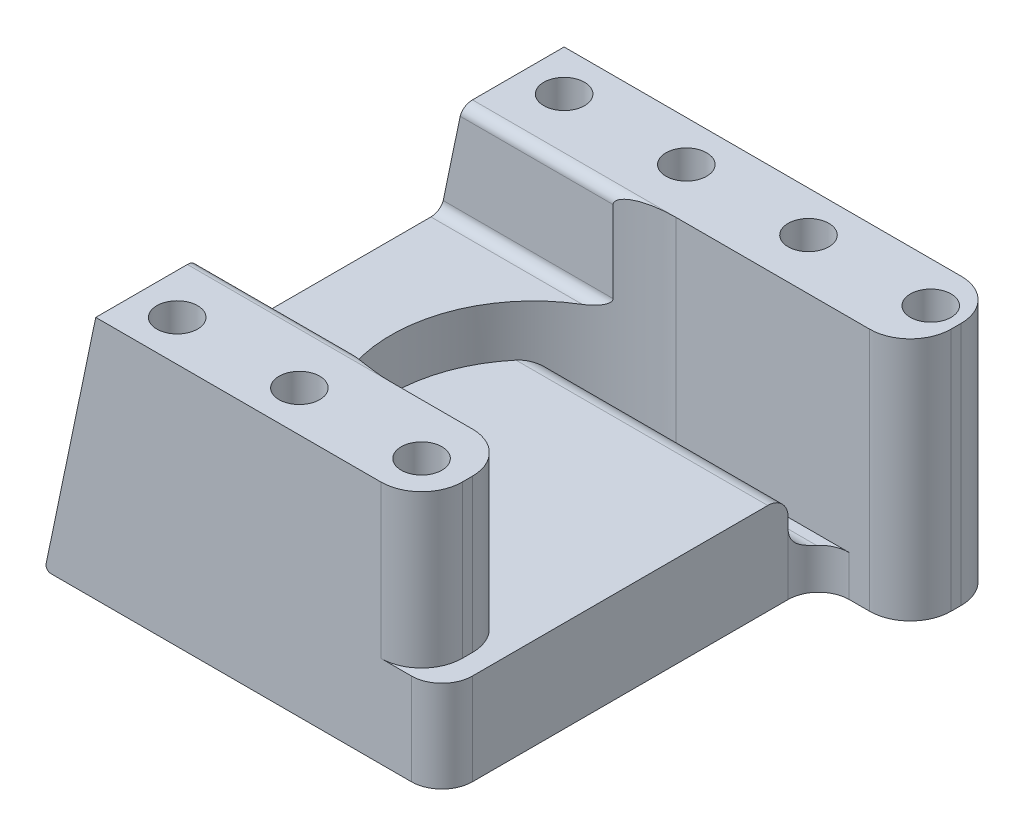
from build123d import *

# Parameters (mm, degrees)
SKETCH2_R           = 2
SKETCH2_R_2         = 2.0000000000000004
SKETCH2_R_3         = 2.0000000000000036
BOSS_EXTRUDE1_DEPTH = 24
BOSS_EXTRUDE2_DEPTH = 46
CUT_EXTRUDE1_START  = -10
CUT_EXTRUDE1_DEPTH  = 10
FILLET1_R           = 1
FILLET2_R           = 0.5
FILLET3_R           = 4
BOSS_EXTRUDE3_START = -9
BOSS_EXTRUDE3_DEPTH = 9
FILLET4_R           = 3
CUT_EXTRUDE2_START  = -5
CUT_EXTRUDE2_DEPTH  = 5
FILLET5_R           = 2


with BuildPart() as part:
    # Sketch2 → Boss-Extrude1 (new body)
    with BuildSketch(Plane(origin=(0, 0, 0), x_dir=(1, 0, 0), z_dir=(0, 1, 0))):
        with BuildLine():
            ThreePointArc((-10.00000000000001, 1.71e-15), (-7.224972160321737, 8.36660026534089), (3.0642e-13, 13.41640786499884))
            ThreePointArc((3.0642e-13, 13.41640786499884), (1.9788258499060016, 13.85333371629342), (4.000000000000001, 14.00000000000001))
            Line((4, 14.00000000000001), (27, 14))
            Line((27, 14), (27, 23.000000000000007))
            Line((27, 23.000000000000007), (-16, 23))
            Line((-16, 23.000000000000004), (-16, -22.999999999999996))
            Line((-16, -22.999999999999996), (15.999999999999996, -22.999999999999993))
            Line((15.999999999999996, -22.999999999999993), (15.999999999999996, -14))
            Line((15.999999999999996, -14), (4, -14.00000000000001))
            ThreePointArc((3.9999999999999973, -14.00000000000001), (-5.899494936611674, -9.899494936611672), (-10.00000000000001, 1.71e-15))
        make_face()
        with Locations(Location((-11.999999999999995, -19, 0), (0, 0, 270))):
            Circle(SKETCH2_R, mode=Mode.SUBTRACT)
        with Locations(Location((4.65e-15, -19, 0), (0, 0, 270))):
            Circle(SKETCH2_R_2, mode=Mode.SUBTRACT)
        with Locations(Location((11.999999999999995, -19, 0), (0, 0, 270))):
            Circle(SKETCH2_R, mode=Mode.SUBTRACT)
        with Locations(Location((-12, 19, 0), (0, 0, 270))):
            Circle(SKETCH2_R_2, mode=Mode.SUBTRACT)
        with Locations(Location((4.7e-16, 19, 0), (0, 0, 270))):
            Circle(SKETCH2_R, mode=Mode.SUBTRACT)
        with Locations(Location((12, 19, 0), (0, 0, 270))):
            Circle(SKETCH2_R, mode=Mode.SUBTRACT)
        with Locations(Location((24.003693078979538, 19, 0), (0, 0, 270))):
            Circle(SKETCH2_R_3, mode=Mode.SUBTRACT)
    extrude(amount=BOSS_EXTRUDE1_DEPTH)

    # Sketch4 → Boss-Extrude2 (add)
    with BuildSketch(Plane.XY.offset(22.999999999999993)):
        Polygon((-21.000000000000004, -1.04e-15), (-16.000000000000004, 24), (-16.000000000000004, 0), align=None)
    extrude(amount=-BOSS_EXTRUDE2_DEPTH)

    # Sketch5 → Cut-Extrude1 (cut)
    with BuildSketch(Plane(origin=(0, 24, 0), x_dir=(1, 0, 0), z_dir=(0, 1, 0)).offset(CUT_EXTRUDE1_START)):
        with BuildLine():
            Line((-16, 0), (-10.000000000000007, 0))
            ThreePointArc((-10.000000000000007, 3.5391e-13), (-7.591939740998584, 7.850282354225094), (-1.1961524227063602, 13.000000000000117))
            Line((-1.196152422706339, 13), (-16, 12.999999999999998))
            Line((-16, 13.000000000000004), (-16, 0))
        make_face()
        Polygon((-21.000000000000004, 0), (-16, 0), (-16, 13.000000000000004), (-21.000000000000004, 12.999999999999998), align=None)
        with BuildLine():
            ThreePointArc((-1.1961524227063673, -13.000000000000114), (-7.591939740998785, -7.850282354224801), (-10.000000000000007, 3.5391e-13))
            Line((-10.000000000000007, 0), (-16, 0))
            Line((-16, 0), (-16, -13))
            Line((-15.999999999999998, -13.000000000000002), (-1.1961524227063371, -13))
        make_face()
        Polygon((-16, -13), (-16, 0), (-21.000000000000004, 0), (-21, -13), align=None)
    extrude(amount=CUT_EXTRUDE1_DEPTH, mode=Mode.SUBTRACT)

    # Fillet1
    fillet1_edges = [part.edges().sort_by_distance(p)[0] for p in [
        (-9.639742878019842, 14, -13.000000000000032),
        (-8.598076211353176, 24, 13.000000000000036),
        (-9.639742878019844, 14, 13.000000000000032),
        (-8.598076211353174, 24, -13.000000000000036),
    ]]
    fillet(fillet1_edges, radius=FILLET1_R - 0.0001)  # a hair under: the kernel refuses the full size

    # Fillet2
    fillet2_edges = [part.edges().sort_by_distance(p)[0] for p in [
        (-21, -1.04e-15, -7.11e-15),
    ]]
    fillet(fillet2_edges, radius=FILLET2_R)

    # Fillet3
    fillet3_edges = [part.edges().sort_by_distance(p)[0] for p in [
        (15.999999999999996, 12, 14),
        (15.999999999999996, 12, 22.999999999999993),
        (27, 12, -23.000000000000007),
        (27, 12, -14),
    ]]
    fillet(fillet3_edges, radius=FILLET3_R)

    # Sketch6 → Boss-Extrude3 (add)
    with BuildSketch(Plane.XZ.offset(BOSS_EXTRUDE3_START)):
        with BuildLine():
            ThreePointArc((4, 14.00000000000001), (-10.00000000000001, 8.6e-16), (3.9999999999999982, -14.00000000000001))
            Line((3.9999999999999964, -14.00000000000001), (18.00000000000001, -13.999999999999998))
            Line((18.00000000000001, -14.000000000000004), (18.00000000000001, 22.999999999999996))
            Line((18.00000000000001, 22.999999999999993), (11.999999999999996, 22.999999999999993))
            ThreePointArc((11.999999999999996, 22.999999999999993), (14.828427124746188, 21.828427124746185), (15.999999999999998, 18.999999999999993))
            Line((15.999999999999996, 18.999999999999993), (15.999999999999996, 18.000000000000007))
            ThreePointArc((15.999999999999996, 18.000000000000007), (14.828427124746185, 15.171572875253815), (11.999999999999993, 14.000000000000005))
            Line((11.999999999999993, 14.000000000000007), (4, 14.000000000000009))
        make_face()
    extrude(amount=BOSS_EXTRUDE3_DEPTH)

    # Fillet4
    fillet4_edges = [part.edges().sort_by_distance(p)[0] for p in [
        (18.00000000000001, 4.5, 22.999999999999993),
        (18.00000000000001, 4.5, -14),
    ]]
    fillet(fillet4_edges, radius=FILLET4_R)

    # Sketch7 → Cut-Extrude2 (cut)
    with BuildSketch(Plane(origin=(0, 9, 0), x_dir=(1, 0, 0), z_dir=(0, 1, 0)).offset(CUT_EXTRUDE2_START)):
        with BuildLine():
            Line((-4.66025403784441, 10.999999999999995), (18.00000000000001, 10.999999999999995))
            ThreePointArc((18.00000000000001, 10.999999999999995), (18.878679656440365, 13.121320343559638), (21.00000000000001, 13.999999999999995))
            Line((21.00000000000001, 13.999999999999995), (4, 14.00000000000001))
            ThreePointArc((4, 14.000000000000009), (-0.5825756949558523, 13.228756555322958), (-4.660254037844406, 10.999999999999995))
        make_face()
    extrude(amount=CUT_EXTRUDE2_DEPTH, mode=Mode.SUBTRACT)

    # Fillet5
    fillet5_edges = [part.edges().sort_by_distance(p)[0] for p in [
        (6.6698729810778, 9, -10.999999999999995),
        (6.6698729810778, 4, -10.999999999999995),
    ]]
    fillet(fillet5_edges, radius=FILLET5_R)


solid = part.part
